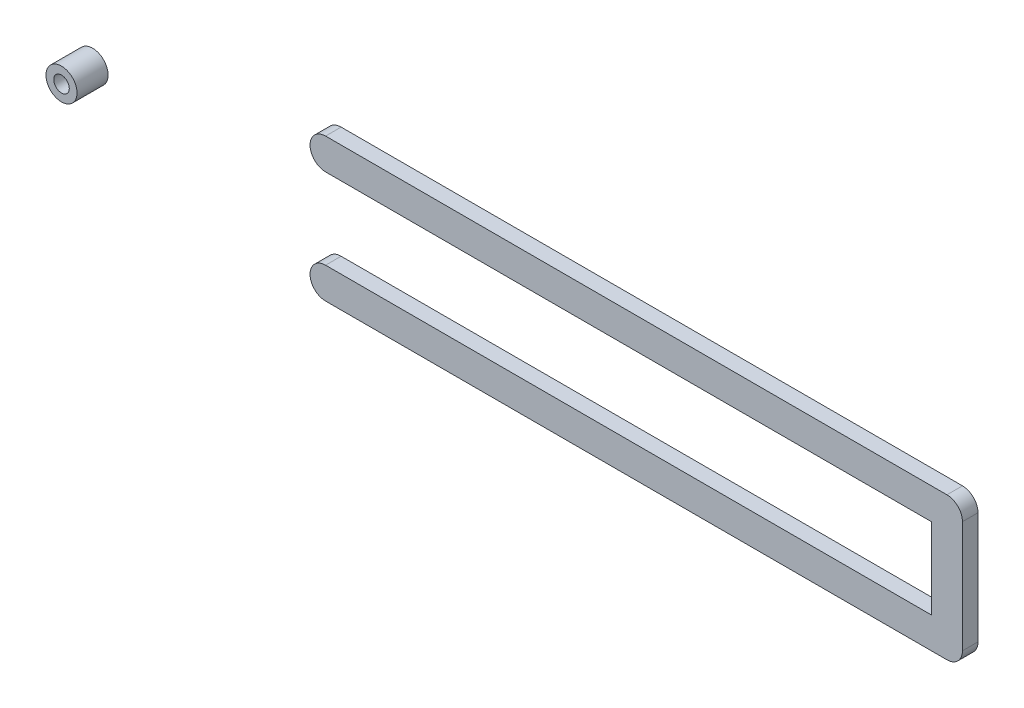
from build123d import *

# Parameters (mm, degrees)
EXTRUDE_1_DEPTH = 10
SKETCH_1_3_R    = 10
SKETCH_1_3_R_2  = 5
EXTRUDE_2_DEPTH = 20
FILLET_1_R      = 10


with BuildPart() as part:
    # 草图1 → 凸台-拉伸1 (new body)
    with BuildSketch(Plane.XY):
        Polygon((0, -20), (0, 0), (400, 0), (400, 52), (0, 52), (0, 72), (420, 72), (420, -20), align=None)
    extrude(amount=EXTRUDE_1_DEPTH)

    # 圆角1
    fillet_1_edges = [part.edges().sort_by_distance(p)[0] for p in [
        (420, -20, 5),
        (420, 72, 5),
        (0, -20, 5),
        (0, 0, 5),
        (0, 52, 5),
        (0, 72, 5),
    ]]
    fillet(fillet_1_edges, radius=FILLET_1_R - 0.0001)  # a hair under: the kernel refuses the full size


with BuildPart() as body_2:
    # 草图1<3> → 凸台-拉伸2 (new body)
    with BuildSketch(Plane.XY):
        with Locations((-150, 26)):
            Circle(SKETCH_1_3_R)
        with Locations((-150, 26)):
            Circle(SKETCH_1_3_R_2, mode=Mode.SUBTRACT)
    extrude(amount=EXTRUDE_2_DEPTH)


solid = Compound([part.part, body_2.part])
